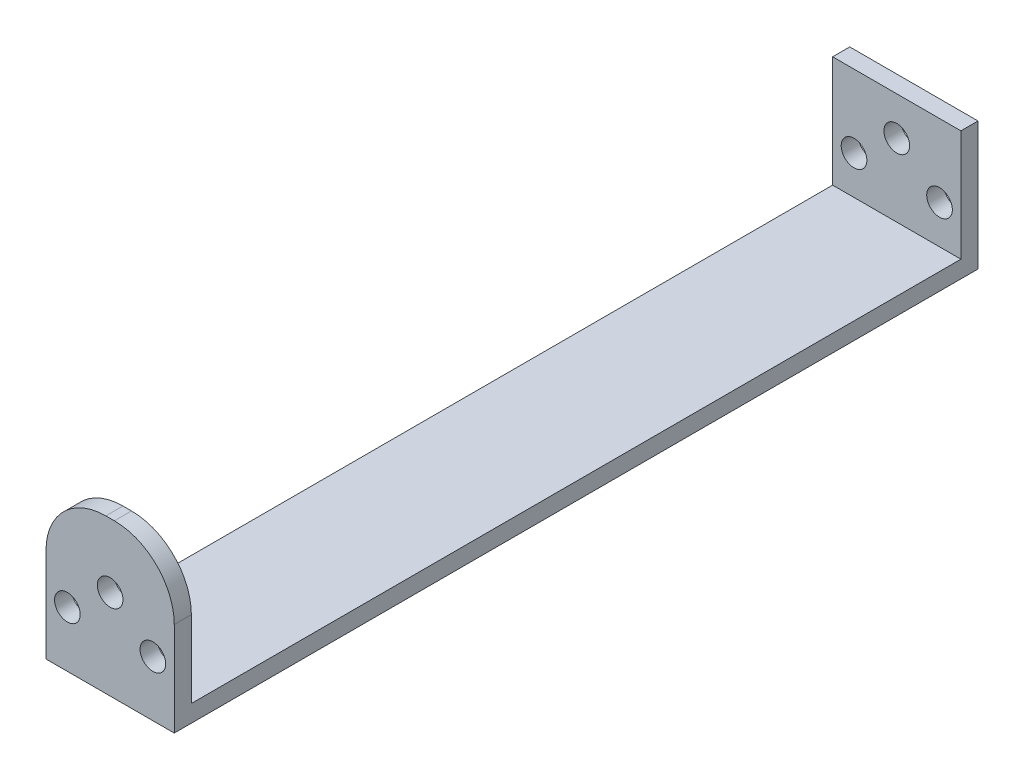
from build123d import *

# Parameters (mm, degrees)
SALIENTE_EXTRUIR1_DEPTH    = 7.5
CORTAR_EXTRUIR1_DEPTH      = 51.212050347
CORTAR_EXTRUIR1_DEPTH_BACK = 51.212050347
CROQUIS2_R                 = 1.5
REDONDEO1_R                = 7


with BuildPart() as part:
    # Croquis1 → Saliente-Extruir1 (new, symmetric)
    with BuildSketch(Plane(origin=(0, 0, 0), x_dir=(0, 0, -1), z_dir=(1, 0, 0))):
        Polygon((-47, 13), (-47, -2), (47, -2), (47, 13), (45, 13), (45, 0), (-45, 0), (-45, 13), (-45, 16), (-47, 16), align=None)
    extrude(amount=SALIENTE_EXTRUIR1_DEPTH, both=True)

    # Croquis2 → Cortar-Extruir1 (cut, two sides: drawn at the far end of the back side and taken through both)
    with BuildSketch(Plane.XY.offset(-CORTAR_EXTRUIR1_DEPTH_BACK)):
        with Locations((0, 8.5)):
            Circle(CROQUIS2_R)
        with Locations((5, 4.5)):
            Circle(CROQUIS2_R)
        with Locations((-5, 4.5)):
            Circle(CROQUIS2_R)
    extrude(amount=CORTAR_EXTRUIR1_DEPTH + CORTAR_EXTRUIR1_DEPTH_BACK, mode=Mode.SUBTRACT)

    # Redondeo1
    redondeo1_edges = [part.edges().sort_by_distance(p)[0] for p in [
        (7.5, 16, 46),
        (-7.5, 16, 46),
    ]]
    fillet(redondeo1_edges, radius=REDONDEO1_R)


solid = part.part
